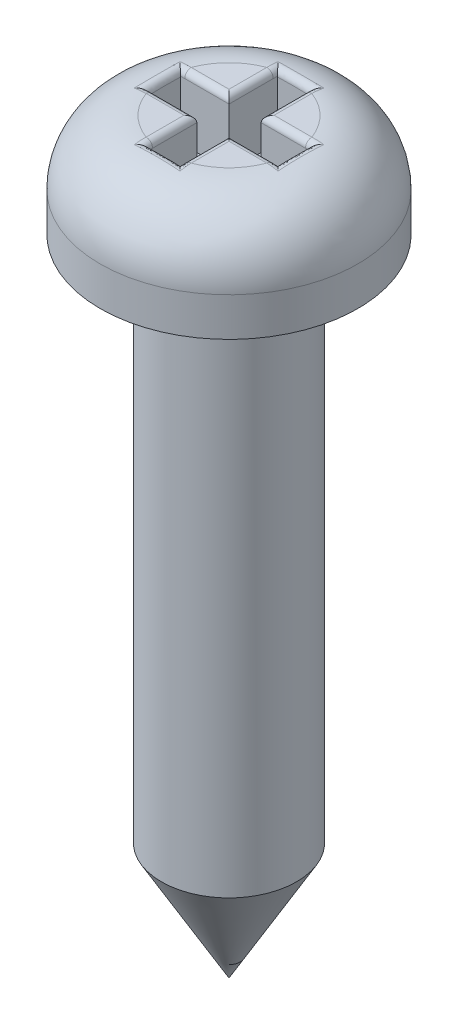
from build123d import *

# Parameters (mm, degrees)
SKETCH1_R           = 2
BOSS_EXTRUDE1_DEPTH = 0.6
SKETCH3_R           = 2
BOSS_EXTRUDE2_DEPTH = 1
FILLET1_R           = 1
CUT_EXTRUDE1_DEPTH  = 1
FILLET2_R           = 0.1
SKETCH5_R           = 1.05
BOSS_EXTRUDE3_DEPTH = 10
CHAMFER1_SIZE       = 1.05
CHAMFER1_SIZE2      = 1.818653348


with BuildPart() as part:
    # Sketch1 → Boss-Extrude1 (new body)
    with BuildSketch(Plane(origin=(0, 0, 0), x_dir=(1, 0, 0), z_dir=(0, 1, 0))):
        Circle(SKETCH1_R)
    extrude(amount=BOSS_EXTRUDE1_DEPTH)

    # Sketch3 → Boss-Extrude2 (add)
    with BuildSketch(Plane(origin=(0, 0.6, 0), x_dir=(1, 0, 0), z_dir=(0, 1, 0))):
        Circle(SKETCH3_R)
    extrude(amount=BOSS_EXTRUDE2_DEPTH)

    # Fillet1
    fillet1_edges = [part.edges().sort_by_distance(p)[0] for p in [
        (-2, 1.6, 0),
    ]]
    fillet(fillet1_edges, radius=FILLET1_R)

    # Sketch4 → Cut-Extrude1 (cut)
    with BuildSketch(Plane(origin=(0, 1.6, 0), x_dir=(1, 0, 0), z_dir=(0, 1, 0))):
        Polygon((-1, -0.25), (-0.25, -0.25), (-0.25, -1), (0.25, -1), (0.25, -0.25), (1, -0.25), (1, 0.25), (0.25, 0.25), (0.25, 1), (-0.25, 1), (-0.25, 0.25), (-1, 0.25), align=None)
    extrude(amount=-CUT_EXTRUDE1_DEPTH, mode=Mode.SUBTRACT)

    # Fillet2
    fillet2_edges = [part.edges().sort_by_distance(p)[0] for p in [
        (0.25, 1.599881683, -0.984124687),
        (-0.25, 1.599881683, 0.984124687),
        (0.984124687, 1.599881683, -0.25),
        (0.984124687, 1.599881683, 0.25),
        (0.25, 1.599881683, 0.984124687),
        (-0.984124687, 1.599881683, 0.25),
        (-0.984124687, 1.599881683, -0.25),
        (-0.25, 1.599881683, -0.984124687),
        (0.25, 1.6, -0.609122918),
        (-0.25, 1.6, 0.609122918),
        (0, 1.599999802, 1),
        (1.2e-08, 1.600001046, -1),
        (1, 1.599969736, -0.125000499),
        (0.609122918, 1.6, -0.25),
        (0.609122918, 1.6, 0.25),
        (0.25, 1.6, 0.609122918),
        (-1, 1.600001046, -1.2e-08),
        (-0.609122918, 1.6, 0.25),
        (-0.609122918, 1.6, -0.25),
        (-0.25, 1.6, -0.609122918),
    ]]
    fillet(fillet2_edges, radius=FILLET2_R)

    # Sketch5 → Boss-Extrude3 (add)
    with BuildSketch(Plane.XZ):
        Circle(SKETCH5_R)
    extrude(amount=BOSS_EXTRUDE3_DEPTH)

    # Chamfer1
    chamfer1_edges = [part.edges().sort_by_distance(p)[0] for p in [
        (-1.05, -10, 0),
    ]]
    chamfer1_side = [part.faces().sort_by_distance(p)[0] for p in [
        (0, -10, 0),
    ]]
    chamfer(chamfer1_edges, length=CHAMFER1_SIZE, length2=CHAMFER1_SIZE2, reference=chamfer1_side[0])


solid = part.part
